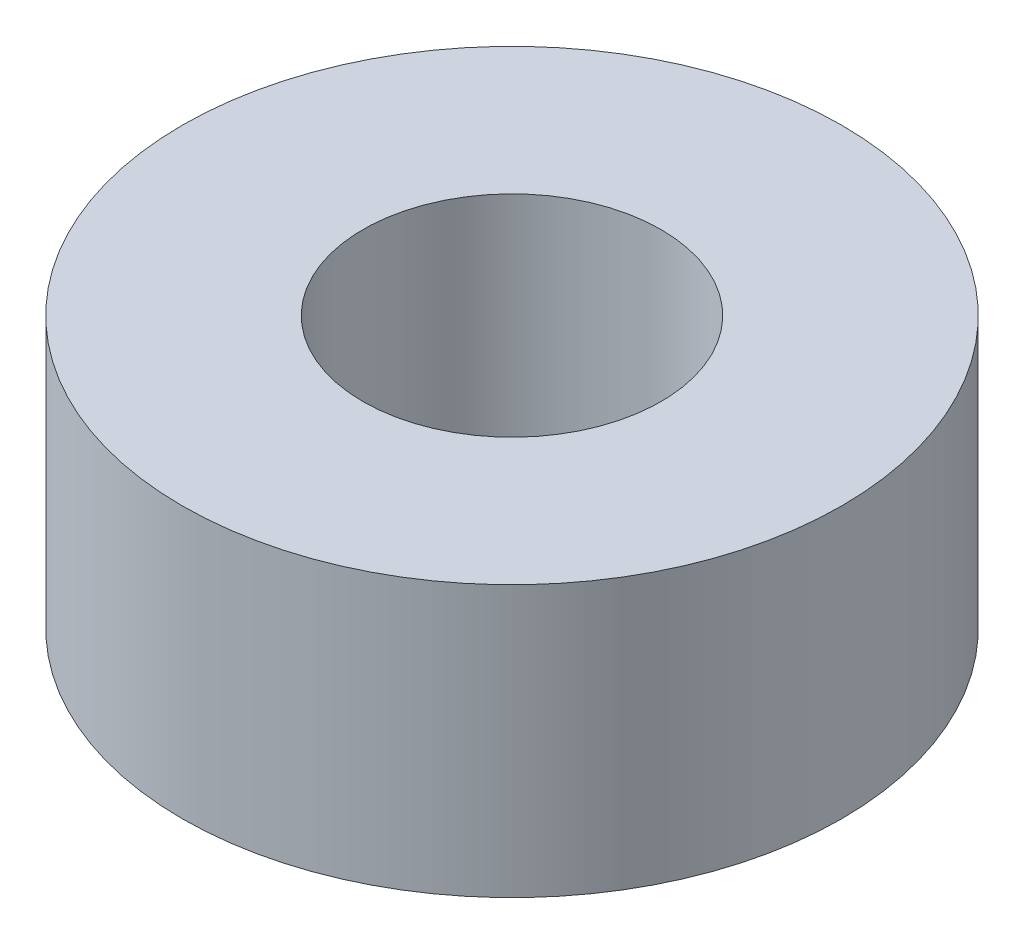
from build123d import *

# Parameters (mm, degrees)
SKETCH1_R           = 3.65
SKETCH1_R_2         = 1.65
BOSS_EXTRUDE1_DEPTH = 3


with BuildPart() as part:
    # Sketch1 → Boss-Extrude1 (new body)
    with BuildSketch(Plane(origin=(0, 0, 0), x_dir=(1, 0, 0), z_dir=(0, 1, 0))):
        Circle(SKETCH1_R)
        Circle(SKETCH1_R_2, mode=Mode.SUBTRACT)
    extrude(amount=BOSS_EXTRUDE1_DEPTH)


solid = part.part
